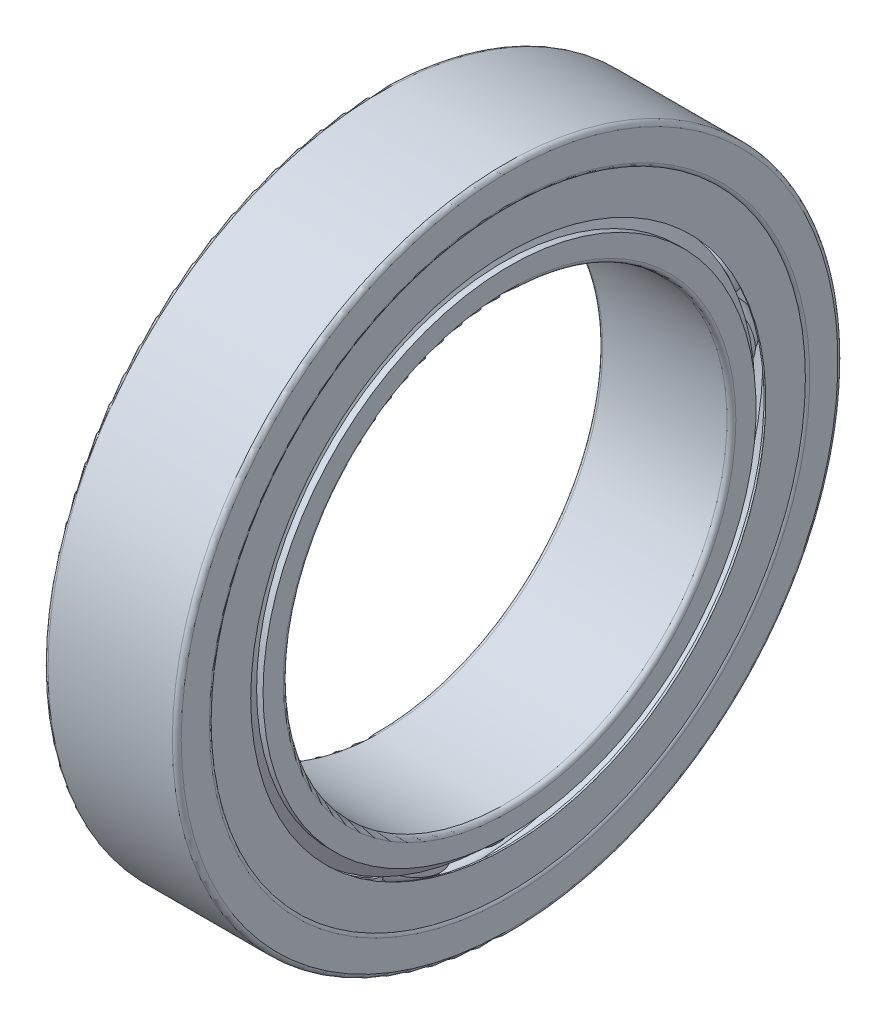
from build123d import *
from build123d.topology import SkipClean

# Parameters (mm, degrees)
SKETCH_5_W               = 0.375
SKETCH_5_H               = 0.25
PATTERN_CIRCULAR_5_COUNT = 25
PATTERN_CIRCULAR_2_COUNT = 25


with BuildPart() as part:
    # 草图2 → 旋转1 (revolve)
    with BuildSketch(Plane.XY):
        with BuildLine():
            Line((1.194444444, 5.833333333), (1.354819519, 5.555555556))
            Line((1.354819519, 5.555555556), (1.5, 5.555555556))
            Line((1.5, 5.555555556), (1.5, 5.1))
            ThreePointArc((1.5, 5.1), (1.470710678, 5.029289322), (1.4, 5))
            Line((1.4, 5), (-1.4, 5))
            ThreePointArc((-1.4, 5), (-1.470710678, 5.029289322), (-1.5, 5.1))
            Line((-1.5, 5.1), (-1.5, 5.555555556))
            Line((-1.5, 5.555555556), (-1.354819519, 5.555555556))
            Line((-1.354819519, 5.555555556), (-1.194444444, 5.833333333))
            Line((-1.194444444, 5.833333333), (-0.465847495, 5.833333333))
            ThreePointArc((-0.465847495, 5.833333333), (0, 5.625), (0.465847495, 5.833333333))
            Line((0.465847495, 5.833333333), (1.194444444, 5.833333333))
        make_face()
        with BuildLine():
            Line((-1.5, 7.4), (-1.5, 6.766666667))
            ThreePointArc((-1.5, 6.766666667), (-1.470710678, 6.695955989), (-1.4, 6.666666667))
            Line((-1.4, 6.666666667), (-0.465847495, 6.666666667))
            ThreePointArc((-0.465847495, 6.666666667), (0, 6.875), (0.465847495, 6.666666667))
            Line((0.465847495, 6.666666667), (1.4, 6.666666667))
            ThreePointArc((1.4, 6.666666667), (1.470710678, 6.695955989), (1.5, 6.766666667))
            Line((1.5, 6.766666667), (1.5, 7.4))
            ThreePointArc((1.5, 7.4), (1.470710678, 7.470710678), (1.4, 7.5))
            Line((1.4, 7.5), (-1.4, 7.5))
            ThreePointArc((-1.4, 7.5), (-1.470710678, 7.470710678), (-1.5, 7.4))
        make_face()
    revolve(axis=Axis((-3.5, 0, 0), (1, 0, 0)))


with BuildPart() as body_2:
    # 草图5 → 旋转3 (revolve)
    with BuildSketch(Plane.XY):
        with Locations((0, 6.25)):
            Rectangle(SKETCH_5_W, SKETCH_5_H)
    revolve(axis=Axis((-19.927092192, 0, 0), (1, 0, 0)))



with BuildPart() as body_3:
    # 草图3 → 旋转2 (revolve)
    with BuildSketch(Plane.XY):
        with BuildLine():
            ThreePointArc((0.6875, 6.25), (0, 6.9375), (-0.6875, 6.25))
            Line((-0.6875, 6.25), (0.6875, 6.25))
        make_face()
    revolve(axis=Axis((-0.6875, 6.25, 0), (1, 0, 0)))


with BuildPart() as pattern_circular_5_1:
    # 阵列(圆周)5: pattern copy
    add(body_3.part.rotate(Axis((-3.85, 0, 0), (1, 0, 0)), 1 * 360 / PATTERN_CIRCULAR_5_COUNT))


with BuildPart() as pattern_circular_5_2:
    # 阵列(圆周)5: pattern copy
    add(body_3.part.rotate(Axis((-3.85, 0, 0), (1, 0, 0)), 2 * 360 / PATTERN_CIRCULAR_5_COUNT))


with BuildPart() as pattern_circular_5_3:
    # 阵列(圆周)5: pattern copy
    add(body_3.part.rotate(Axis((-3.85, 0, 0), (1, 0, 0)), 3 * 360 / PATTERN_CIRCULAR_5_COUNT))


with BuildPart() as pattern_circular_5_4:
    # 阵列(圆周)5: pattern copy
    add(body_3.part.rotate(Axis((-3.85, 0, 0), (1, 0, 0)), 4 * 360 / PATTERN_CIRCULAR_5_COUNT))


with BuildPart() as pattern_circular_5_5:
    # 阵列(圆周)5: pattern copy
    add(body_3.part.rotate(Axis((-3.85, 0, 0), (1, 0, 0)), 5 * 360 / PATTERN_CIRCULAR_5_COUNT))


with BuildPart() as pattern_circular_5_6:
    # 阵列(圆周)5: pattern copy
    add(body_3.part.rotate(Axis((-3.85, 0, 0), (1, 0, 0)), 6 * 360 / PATTERN_CIRCULAR_5_COUNT))


with BuildPart() as pattern_circular_5_7:
    # 阵列(圆周)5: pattern copy
    add(body_3.part.rotate(Axis((-3.85, 0, 0), (1, 0, 0)), 7 * 360 / PATTERN_CIRCULAR_5_COUNT))


with BuildPart() as pattern_circular_5_8:
    # 阵列(圆周)5: pattern copy
    add(body_3.part.rotate(Axis((-3.85, 0, 0), (1, 0, 0)), 8 * 360 / PATTERN_CIRCULAR_5_COUNT))


with BuildPart() as pattern_circular_5_9:
    # 阵列(圆周)5: pattern copy
    add(body_3.part.rotate(Axis((-3.85, 0, 0), (1, 0, 0)), 9 * 360 / PATTERN_CIRCULAR_5_COUNT))


with BuildPart() as pattern_circular_5_10:
    # 阵列(圆周)5: pattern copy
    add(body_3.part.rotate(Axis((-3.85, 0, 0), (1, 0, 0)), 10 * 360 / PATTERN_CIRCULAR_5_COUNT))


with BuildPart() as pattern_circular_5_11:
    # 阵列(圆周)5: pattern copy
    add(body_3.part.rotate(Axis((-3.85, 0, 0), (1, 0, 0)), 11 * 360 / PATTERN_CIRCULAR_5_COUNT))


with BuildPart() as pattern_circular_5_12:
    # 阵列(圆周)5: pattern copy
    add(body_3.part.rotate(Axis((-3.85, 0, 0), (1, 0, 0)), 12 * 360 / PATTERN_CIRCULAR_5_COUNT))


with BuildPart() as pattern_circular_5_13:
    # 阵列(圆周)5: pattern copy
    add(body_3.part.rotate(Axis((-3.85, 0, 0), (1, 0, 0)), 13 * 360 / PATTERN_CIRCULAR_5_COUNT))


with BuildPart() as pattern_circular_5_14:
    # 阵列(圆周)5: pattern copy
    add(body_3.part.rotate(Axis((-3.85, 0, 0), (1, 0, 0)), 14 * 360 / PATTERN_CIRCULAR_5_COUNT))


with BuildPart() as pattern_circular_5_15:
    # 阵列(圆周)5: pattern copy
    add(body_3.part.rotate(Axis((-3.85, 0, 0), (1, 0, 0)), 15 * 360 / PATTERN_CIRCULAR_5_COUNT))


with BuildPart() as pattern_circular_5_16:
    # 阵列(圆周)5: pattern copy
    add(body_3.part.rotate(Axis((-3.85, 0, 0), (1, 0, 0)), 16 * 360 / PATTERN_CIRCULAR_5_COUNT))


with BuildPart() as pattern_circular_5_17:
    # 阵列(圆周)5: pattern copy
    add(body_3.part.rotate(Axis((-3.85, 0, 0), (1, 0, 0)), 17 * 360 / PATTERN_CIRCULAR_5_COUNT))


with BuildPart() as pattern_circular_5_18:
    # 阵列(圆周)5: pattern copy
    add(body_3.part.rotate(Axis((-3.85, 0, 0), (1, 0, 0)), 18 * 360 / PATTERN_CIRCULAR_5_COUNT))


with BuildPart() as pattern_circular_5_19:
    # 阵列(圆周)5: pattern copy
    add(body_3.part.rotate(Axis((-3.85, 0, 0), (1, 0, 0)), 19 * 360 / PATTERN_CIRCULAR_5_COUNT))


with BuildPart() as pattern_circular_5_20:
    # 阵列(圆周)5: pattern copy
    add(body_3.part.rotate(Axis((-3.85, 0, 0), (1, 0, 0)), 20 * 360 / PATTERN_CIRCULAR_5_COUNT))


with BuildPart() as pattern_circular_5_21:
    # 阵列(圆周)5: pattern copy
    add(body_3.part.rotate(Axis((-3.85, 0, 0), (1, 0, 0)), 21 * 360 / PATTERN_CIRCULAR_5_COUNT))


with BuildPart() as pattern_circular_5_22:
    # 阵列(圆周)5: pattern copy
    add(body_3.part.rotate(Axis((-3.85, 0, 0), (1, 0, 0)), 22 * 360 / PATTERN_CIRCULAR_5_COUNT))


with BuildPart() as pattern_circular_5_23:
    # 阵列(圆周)5: pattern copy
    add(body_3.part.rotate(Axis((-3.85, 0, 0), (1, 0, 0)), 23 * 360 / PATTERN_CIRCULAR_5_COUNT))


with BuildPart() as pattern_circular_5_24:
    # 阵列(圆周)5: pattern copy
    add(body_3.part.rotate(Axis((-3.85, 0, 0), (1, 0, 0)), 24 * 360 / PATTERN_CIRCULAR_5_COUNT))


with BuildPart() as cut_revolve_1_tool:
    # 草图6 → 切除-旋转1 (revolve)
    with BuildSketch(Plane.XY):
        with BuildLine():
            Line((-0.676040864, 6.375), (0.676040864, 6.375))
            ThreePointArc((0.676040864, 6.375), (0, 6.9375), (-0.676040864, 6.375))
        make_face()
        with BuildLine():
            Line((-0.676040864, 6.125), (0.676040864, 6.125))
            ThreePointArc((0.676040864, 6.125), (0, 5.5625), (-0.676040864, 6.125))
        make_face()
    revolve(axis=Axis((-19.927092192, 0, 0), (1, 0, 0)))


with BuildPart() as part_1:
    add(part.part)

    # 切除-旋转1: cut by cut_revolve_1_tool
    add(cut_revolve_1_tool.part, mode=Mode.SUBTRACT)

    # 草图9 → 旋转5 (revolve)
    with BuildSketch(Plane.XY):
        with BuildLine():
            Line((1.4, 6.666666667), (1.4, 5.833333333))
            ThreePointArc((1.4, 5.833333333), (1.438268343, 5.825721287), (1.470710678, 5.804044011))
            Line((1.470710678, 5.804044011), (1.470710678, 6.695955989))
            ThreePointArc((1.470710678, 6.695955989), (1.438268343, 6.674278713), (1.4, 6.666666667))
        make_face()
        with BuildLine():
            Line((-1.470710678, 6.695955989), (-1.470710678, 5.804044011))
            ThreePointArc((-1.470710678, 5.804044011), (-1.438268343, 5.825721287), (-1.4, 5.833333333))
            Line((-1.4, 5.833333333), (-1.4, 6.666666667))
            ThreePointArc((-1.4, 6.666666667), (-1.438268343, 6.674278713), (-1.470710678, 6.695955989))
        make_face()
    revolve(axis=Axis((-19.927092192, 0, 0), (1, 0, 0)))


with BuildPart() as body_3_1:
    add(body_3.part)

    # 切除-旋转1: cut by cut_revolve_1_tool
    add(cut_revolve_1_tool.part, mode=Mode.SUBTRACT)


with BuildPart() as pattern_circular_5_1_1:
    add(pattern_circular_5_1.part)

    # 切除-旋转1: cut by cut_revolve_1_tool
    add(cut_revolve_1_tool.part, mode=Mode.SUBTRACT)


with BuildPart() as pattern_circular_5_2_1:
    add(pattern_circular_5_2.part)

    # 切除-旋转1: cut by cut_revolve_1_tool
    add(cut_revolve_1_tool.part, mode=Mode.SUBTRACT)


with BuildPart() as pattern_circular_5_3_1:
    add(pattern_circular_5_3.part)

    # 切除-旋转1: cut by cut_revolve_1_tool
    add(cut_revolve_1_tool.part, mode=Mode.SUBTRACT)


with BuildPart() as pattern_circular_5_4_1:
    add(pattern_circular_5_4.part)

    # 切除-旋转1: cut by cut_revolve_1_tool
    add(cut_revolve_1_tool.part, mode=Mode.SUBTRACT)


with BuildPart() as pattern_circular_5_5_1:
    add(pattern_circular_5_5.part)

    # 切除-旋转1: cut by cut_revolve_1_tool
    add(cut_revolve_1_tool.part, mode=Mode.SUBTRACT)


with BuildPart() as pattern_circular_5_6_1:
    add(pattern_circular_5_6.part)

    # 切除-旋转1: cut by cut_revolve_1_tool
    add(cut_revolve_1_tool.part, mode=Mode.SUBTRACT)


with BuildPart() as pattern_circular_5_7_1:
    add(pattern_circular_5_7.part)

    # 切除-旋转1: cut by cut_revolve_1_tool
    add(cut_revolve_1_tool.part, mode=Mode.SUBTRACT)


with BuildPart() as pattern_circular_5_8_1:
    add(pattern_circular_5_8.part)

    # 切除-旋转1: cut by cut_revolve_1_tool
    add(cut_revolve_1_tool.part, mode=Mode.SUBTRACT)


with BuildPart() as pattern_circular_5_9_1:
    add(pattern_circular_5_9.part)

    # 切除-旋转1: cut by cut_revolve_1_tool
    add(cut_revolve_1_tool.part, mode=Mode.SUBTRACT)


with BuildPart() as pattern_circular_5_10_1:
    add(pattern_circular_5_10.part)

    # 切除-旋转1: cut by cut_revolve_1_tool
    add(cut_revolve_1_tool.part, mode=Mode.SUBTRACT)


with BuildPart() as pattern_circular_5_11_1:
    add(pattern_circular_5_11.part)

    # 切除-旋转1: cut by cut_revolve_1_tool
    add(cut_revolve_1_tool.part, mode=Mode.SUBTRACT)


with BuildPart() as pattern_circular_5_12_1:
    add(pattern_circular_5_12.part)

    # 切除-旋转1: cut by cut_revolve_1_tool
    add(cut_revolve_1_tool.part, mode=Mode.SUBTRACT)


with BuildPart() as pattern_circular_5_13_1:
    add(pattern_circular_5_13.part)

    # 切除-旋转1: cut by cut_revolve_1_tool
    add(cut_revolve_1_tool.part, mode=Mode.SUBTRACT)


with BuildPart() as pattern_circular_5_14_1:
    add(pattern_circular_5_14.part)

    # 切除-旋转1: cut by cut_revolve_1_tool
    add(cut_revolve_1_tool.part, mode=Mode.SUBTRACT)


with BuildPart() as pattern_circular_5_15_1:
    add(pattern_circular_5_15.part)

    # 切除-旋转1: cut by cut_revolve_1_tool
    add(cut_revolve_1_tool.part, mode=Mode.SUBTRACT)


with BuildPart() as pattern_circular_5_16_1:
    add(pattern_circular_5_16.part)

    # 切除-旋转1: cut by cut_revolve_1_tool
    add(cut_revolve_1_tool.part, mode=Mode.SUBTRACT)


with BuildPart() as pattern_circular_5_17_1:
    add(pattern_circular_5_17.part)

    # 切除-旋转1: cut by cut_revolve_1_tool
    add(cut_revolve_1_tool.part, mode=Mode.SUBTRACT)


with BuildPart() as pattern_circular_5_18_1:
    add(pattern_circular_5_18.part)

    # 切除-旋转1: cut by cut_revolve_1_tool
    add(cut_revolve_1_tool.part, mode=Mode.SUBTRACT)


with BuildPart() as pattern_circular_5_19_1:
    add(pattern_circular_5_19.part)

    # 切除-旋转1: cut by cut_revolve_1_tool
    add(cut_revolve_1_tool.part, mode=Mode.SUBTRACT)


with BuildPart() as pattern_circular_5_20_1:
    add(pattern_circular_5_20.part)

    # 切除-旋转1: cut by cut_revolve_1_tool
    add(cut_revolve_1_tool.part, mode=Mode.SUBTRACT)


with BuildPart() as pattern_circular_5_21_1:
    add(pattern_circular_5_21.part)

    # 切除-旋转1: cut by cut_revolve_1_tool
    add(cut_revolve_1_tool.part, mode=Mode.SUBTRACT)


with BuildPart() as pattern_circular_5_22_1:
    add(pattern_circular_5_22.part)

    # 切除-旋转1: cut by cut_revolve_1_tool
    add(cut_revolve_1_tool.part, mode=Mode.SUBTRACT)


with BuildPart() as pattern_circular_5_23_1:
    add(pattern_circular_5_23.part)

    # 切除-旋转1: cut by cut_revolve_1_tool
    add(cut_revolve_1_tool.part, mode=Mode.SUBTRACT)


with BuildPart() as pattern_circular_5_24_1:
    add(pattern_circular_5_24.part)

    # 切除-旋转1: cut by cut_revolve_1_tool
    add(cut_revolve_1_tool.part, mode=Mode.SUBTRACT)


with BuildPart() as body_2_1:
    with SkipClean():  # the faces are left unmerged after this step: merging them gives an invalid solid
        add(body_2.part)

        add(body_3_1.part)  # 旋转4 merges body 3
        # 草图7 → 旋转4 (revolve)
        with BuildSketch(Plane.XY):
            with BuildLine():
                Line((-0.625, 6.25), (0.625, 6.25))
                ThreePointArc((0.625, 6.25), (0, 6.875), (-0.625, 6.25))
            make_face()
        revolve_4 = revolve(axis=Axis((-0.625, 6.25, 0), (1, 0, 0)))

    # 阵列(圆周)2: 旋转4 ×25 about axis
    with SkipClean():  # the faces are left unmerged after this step: merging them gives an invalid solid
        pattern_circular_2_axis = Axis((-3.85, 0, 0), (1, 0, 0))
        for i in range(1, PATTERN_CIRCULAR_2_COUNT):
            add(revolve_4.rotate(pattern_circular_2_axis, i * 360 / PATTERN_CIRCULAR_2_COUNT))


solid = Compound([part_1.part, pattern_circular_5_1_1.part, pattern_circular_5_2_1.part, pattern_circular_5_3_1.part, pattern_circular_5_4_1.part, pattern_circular_5_5_1.part, pattern_circular_5_6_1.part, pattern_circular_5_7_1.part, pattern_circular_5_8_1.part, pattern_circular_5_9_1.part, pattern_circular_5_10_1.part, pattern_circular_5_11_1.part, pattern_circular_5_12_1.part, pattern_circular_5_13_1.part, pattern_circular_5_14_1.part, pattern_circular_5_15_1.part, pattern_circular_5_16_1.part, pattern_circular_5_17_1.part, pattern_circular_5_18_1.part, pattern_circular_5_19_1.part, pattern_circular_5_20_1.part, pattern_circular_5_21_1.part, pattern_circular_5_22_1.part, pattern_circular_5_23_1.part, pattern_circular_5_24_1.part, body_2_1.part])
